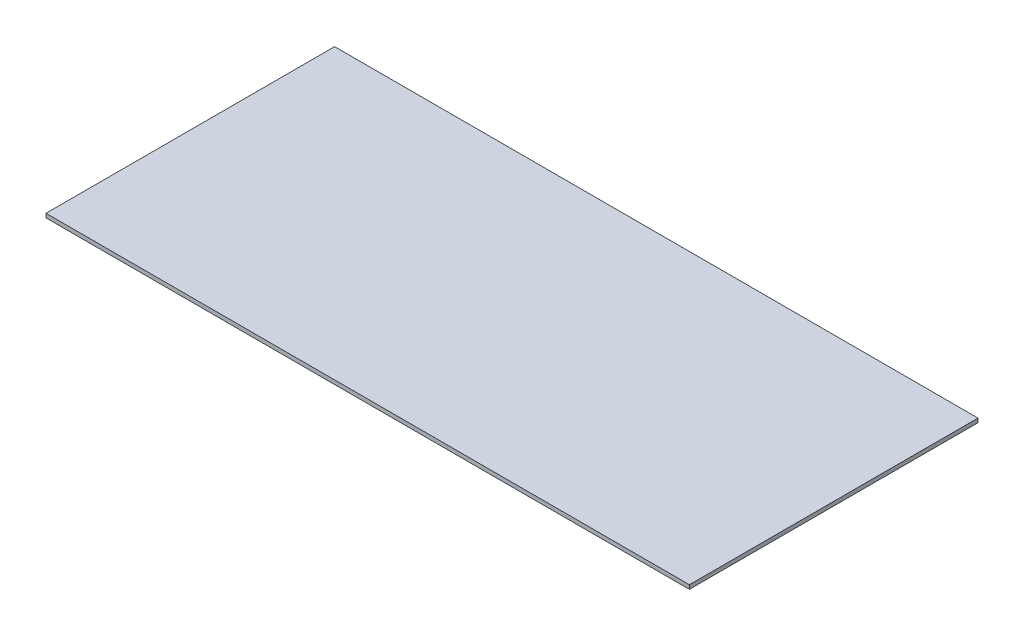
from build123d import *

# Parameters (mm, degrees)
SKETCH1_W           = 2038.35
SKETCH1_H           = 914.4
BOSS_EXTRUDE1_DEPTH = 12.7


with BuildPart() as part:
    # Sketch1 → Boss-Extrude1 (new body)
    with BuildSketch(Plane(origin=(0, 0, 0), x_dir=(1, 0, 0), z_dir=(0, 1, 0))):
        with Locations((1019.175, 457.2)):
            Rectangle(SKETCH1_W, SKETCH1_H)
    extrude(amount=BOSS_EXTRUDE1_DEPTH)


solid = part.part
